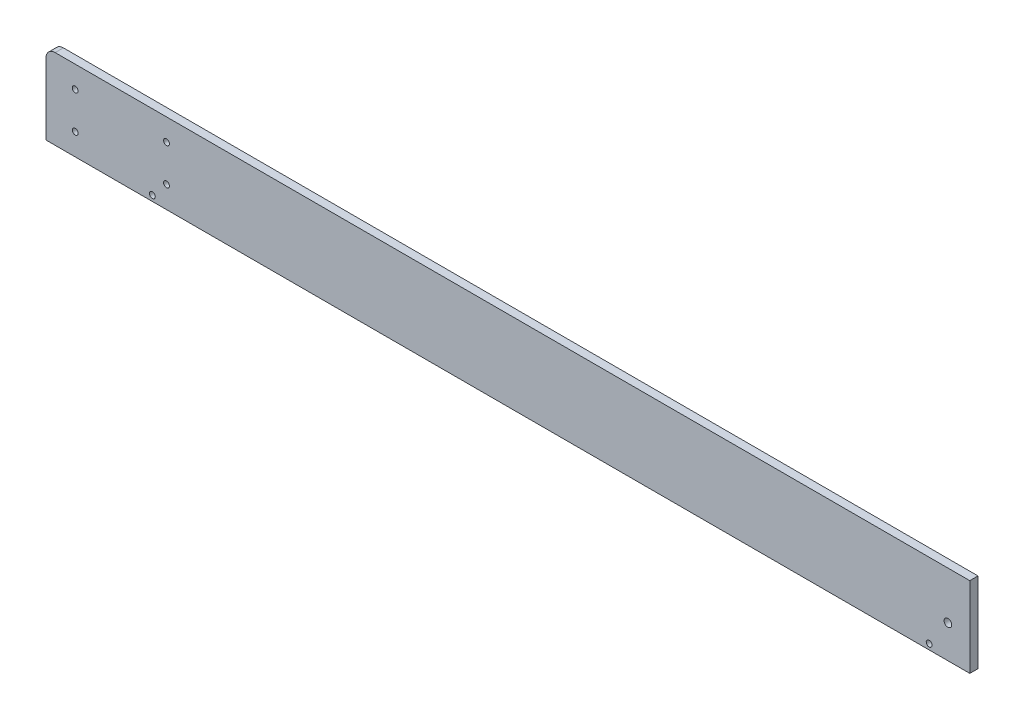
from build123d import *

# Parameters (mm, degrees)
SKETCH1_W           = 506
SKETCH1_H           = 44
SKETCH1_R           = 2.1
SKETCH1_R_2         = 1.6
BOSS_EXTRUDE1_DEPTH = 4.5
FILLET1_R           = 5


with BuildPart() as part:
    # Sketch1 → Boss-Extrude1 (new body)
    with BuildSketch(Plane.XY):
        Rectangle(SKETCH1_W, SKETCH1_H)
        with Locations((241, -4)):
            Circle(SKETCH1_R, mode=Mode.SUBTRACT)
        with Locations((-237, 10)):
            Circle(SKETCH1_R_2, mode=Mode.SUBTRACT)
        with Locations((-187, 10)):
            Circle(SKETCH1_R_2, mode=Mode.SUBTRACT)
        with Locations((-187, -10)):
            Circle(SKETCH1_R_2, mode=Mode.SUBTRACT)
        with Locations((-237, -10)):
            Circle(SKETCH1_R_2, mode=Mode.SUBTRACT)
        with Locations((230.75, -19)):
            Circle(SKETCH1_R_2, mode=Mode.SUBTRACT)
        with Locations((-194.75, -19)):
            Circle(SKETCH1_R_2, mode=Mode.SUBTRACT)
    extrude(amount=BOSS_EXTRUDE1_DEPTH)

    # Fillet1
    fillet1_edges = [part.edges().sort_by_distance(p)[0] for p in [
        (-253, 22, 2.25),
    ]]
    fillet(fillet1_edges, radius=FILLET1_R)


solid = part.part
